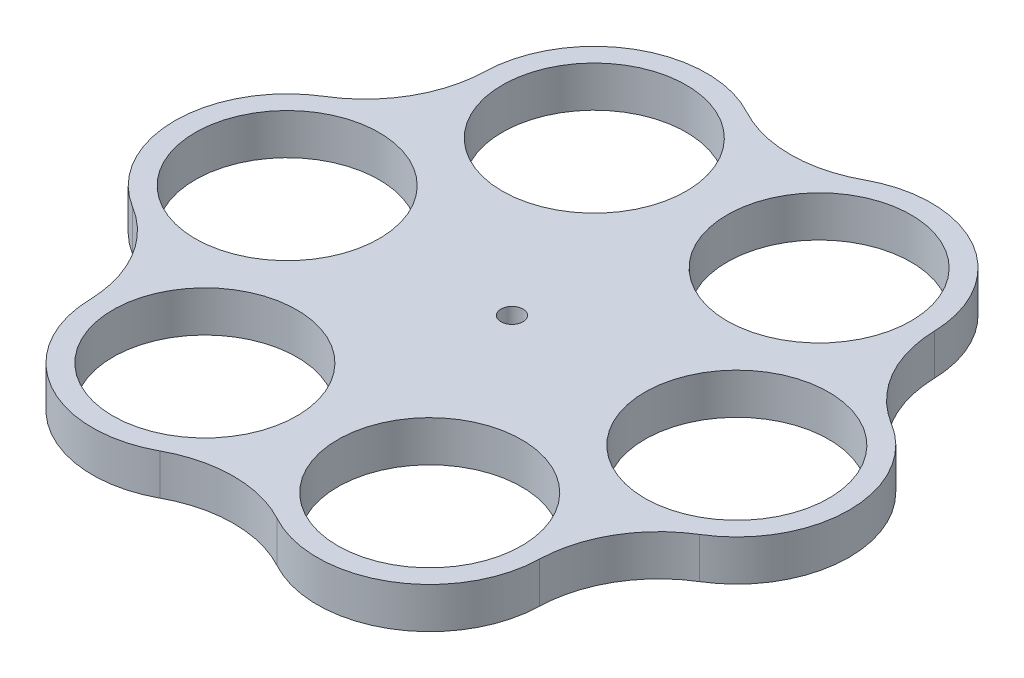
from build123d import *

# Parameters (mm, degrees)
SKETCH1_R           = 22.5
SKETCH1_R_2         = 2.7
BOSS_EXTRUDE1_DEPTH = 10


with BuildPart() as part:
    # Sketch1 → Boss-Extrude1 (new body)
    with BuildSketch(Plane(origin=(0, 0, 0), x_dir=(1, 0, 0), z_dir=(0, 1, 0))):
        with BuildLine():
            ThreePointArc((69.339283971, 23.465611759), (59.001377098, 34.06446095), (54.991457884, 48.316775519))
            ThreePointArc((54.991457884, 48.316775519), (41.25, 71.447095812), (14.347826087, 71.782387278))
            ThreePointArc((14.347826087, 71.782387278), (0, 68.1289219), (-14.347826087, 71.782387278))
            ThreePointArc((-14.347826087, 71.782387278), (-41.25, 71.447095812), (-54.991457884, 48.316775519))
            ThreePointArc((-54.991457884, 48.316775519), (-59.001377098, 34.06446095), (-69.339283971, 23.465611759))
            ThreePointArc((-69.339283971, 23.465611759), (-82.5, 0), (-69.339283971, -23.465611759))
            ThreePointArc((-69.339283971, -23.465611759), (-59.001377098, -34.06446095), (-54.991457884, -48.316775519))
            ThreePointArc((-54.991457884, -48.316775519), (-41.25, -71.447095812), (-14.347826087, -71.782387278))
            ThreePointArc((-14.347826087, -71.782387278), (0, -68.1289219), (14.347826087, -71.782387278))
            ThreePointArc((14.347826087, -71.782387278), (41.25, -71.447095812), (54.991457884, -48.316775519))
            ThreePointArc((54.991457884, -48.316775519), (59.001377098, -34.06446095), (69.339283971, -23.465611759))
            ThreePointArc((69.339283971, -23.465611759), (82.5, 0), (69.339283971, 23.465611759))
        make_face()
        with Locations((-27.5, -47.631397208)):
            Circle(SKETCH1_R, mode=Mode.SUBTRACT)
        with Locations((-55, 0)):
            Circle(SKETCH1_R, mode=Mode.SUBTRACT)
        with Locations((27.5, -47.631397208)):
            Circle(SKETCH1_R, mode=Mode.SUBTRACT)
        Circle(SKETCH1_R_2, mode=Mode.SUBTRACT)
        with Locations((55, 0)):
            Circle(SKETCH1_R, mode=Mode.SUBTRACT)
        with Locations((-27.5, 47.631397208)):
            Circle(SKETCH1_R, mode=Mode.SUBTRACT)
        with Locations((27.5, 47.631397208)):
            Circle(SKETCH1_R, mode=Mode.SUBTRACT)
    extrude(amount=BOSS_EXTRUDE1_DEPTH)


solid = part.part
